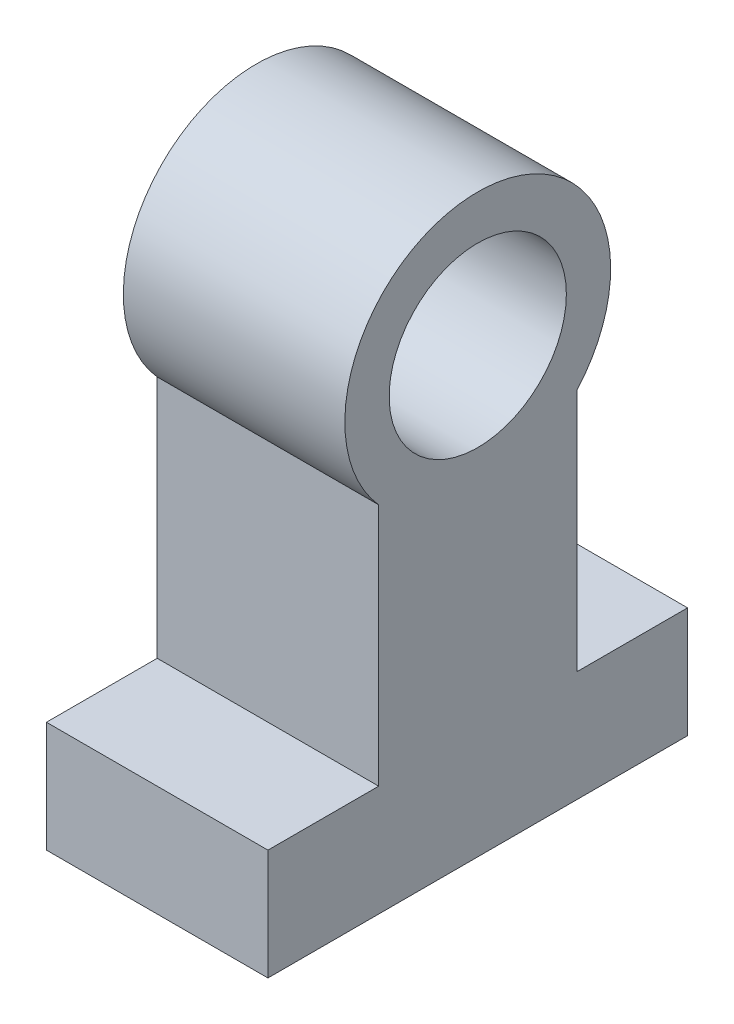
from build123d import *

# Parameters (mm, degrees)
LINKFRAME_R         = 40
BOSS_EXTRUDE1_DEPTH = 100


with BuildPart() as part:
    # LinkFrame → Boss-Extrude1 (new body)
    with BuildSketch(Plane(origin=(0, 0, 0), x_dir=(0, 0, -1), z_dir=(1, 0, 0))):
        with BuildLine():
            Line((306.189243962, -256.043560924), (306.189243962, -366.043560924))
            Line((306.189243962, -366.043560924), (356.189243962, -366.043560924))
            Line((356.189243962, -366.043560924), (356.189243962, -416.043560924))
            Line((356.189243962, -416.043560924), (166.746524862, -416.043560924))
            Line((166.746524862, -416.043560924), (166.746524862, -366.043560924))
            Line((166.746524862, -366.043560924), (216.746524862, -366.043560924))
            Line((216.746524862, -366.043560924), (216.746524862, -256.043560924))
            ThreePointArc((216.746524862, -256.043560924), (261.467884412, -156.043560924), (306.189243962, -256.043560924))
        make_face()
        with Locations((261.467884412, -216.043560924)):
            Circle(LINKFRAME_R, mode=Mode.SUBTRACT)
    extrude(amount=BOSS_EXTRUDE1_DEPTH)


solid = part.part
